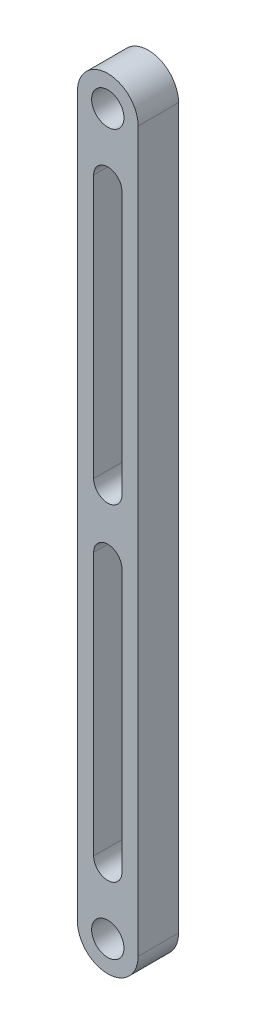
from build123d import *

# Parameters (mm, degrees)
SKETCH1_R           = 4
BOSS_EXTRUDE1_DEPTH = 10


with BuildPart() as part:
    # Sketch1 → Boss-Extrude1 (new body)
    with BuildSketch(Plane.XY):
        with BuildLine():
            Line((-7.5, -88.9), (-7.5, 88.9))
            ThreePointArc((-7.5, 88.9), (0, 96.4), (7.5, 88.9))
            Line((7.5, 88.9), (7.5, -88.9))
            ThreePointArc((7.5, -88.9), (0, -96.4), (-7.5, -88.9))
        make_face()
        with Locations((0, -88.9)):
            Circle(SKETCH1_R, mode=Mode.SUBTRACT)
        with Locations((0, 88.9)):
            Circle(SKETCH1_R, mode=Mode.SUBTRACT)
        with BuildLine():
            Line((-3.5, -72.9), (-3.5, -7.9))
            ThreePointArc((-3.5, -7.9), (0, -4.4), (3.5, -7.9))
            Line((3.5, -7.9), (3.5, -72.9))
            ThreePointArc((3.5, -72.9), (0, -76.4), (-3.5, -72.9))
        make_face(mode=Mode.SUBTRACT)
        with BuildLine():
            Line((3.5, 72.9), (3.5, 7.9))
            ThreePointArc((3.5, 7.9), (0, 4.4), (-3.5, 7.9))
            Line((-3.5, 7.9), (-3.5, 72.9))
            ThreePointArc((-3.5, 72.9), (0, 76.4), (3.5, 72.9))
        make_face(mode=Mode.SUBTRACT)
    extrude(amount=BOSS_EXTRUDE1_DEPTH)


solid = part.part
